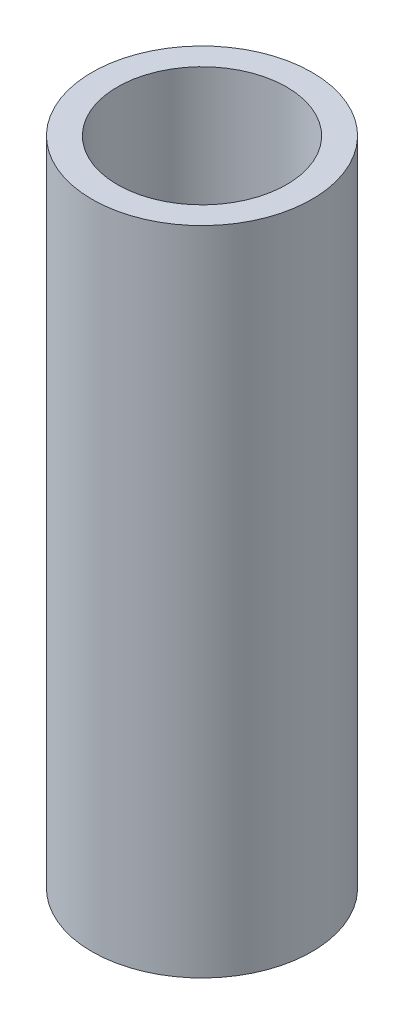
from build123d import *

# Parameters (mm, degrees)
SKETCH1_R           = 1.3
BOSS_EXTRUDE1_DEPTH = 7.7
SKETCH2_R           = 1
CUT_EXTRUDE1_DEPTH  = 7.2
CUT_EXTRUDE2_REACH  = 9.916
SKETCH3_R           = 0.5


with BuildPart() as part:
    # Sketch1 → Boss-Extrude1 (new body)
    with BuildSketch(Plane(origin=(0, 0, 0), x_dir=(1, 0, 0), z_dir=(0, 1, 0))):
        Circle(SKETCH1_R)
    extrude(amount=BOSS_EXTRUDE1_DEPTH)

    # Sketch2 → Cut-Extrude1 (cut)
    with BuildSketch(Plane(origin=(0, 7.7, 0), x_dir=(1, 0, 0), z_dir=(0, 1, 0))):
        Circle(SKETCH2_R)
    extrude(amount=-CUT_EXTRUDE1_DEPTH, mode=Mode.SUBTRACT)

    # Sketch3 → Cut-Extrude2 (cut, up to next)
    with BuildSketch(Plane.XZ, mode=Mode.PRIVATE) as cut_extrude2_sk1:
        Circle(SKETCH3_R)
    cut_extrude2_tool1 = extrude(cut_extrude2_sk1.sketch, amount=-CUT_EXTRUDE2_REACH, mode=Mode.PRIVATE) & part.part
    add(cut_extrude2_tool1.solids().sort_by_distance((0, 0, 0))[0], mode=Mode.SUBTRACT)


solid = part.part
